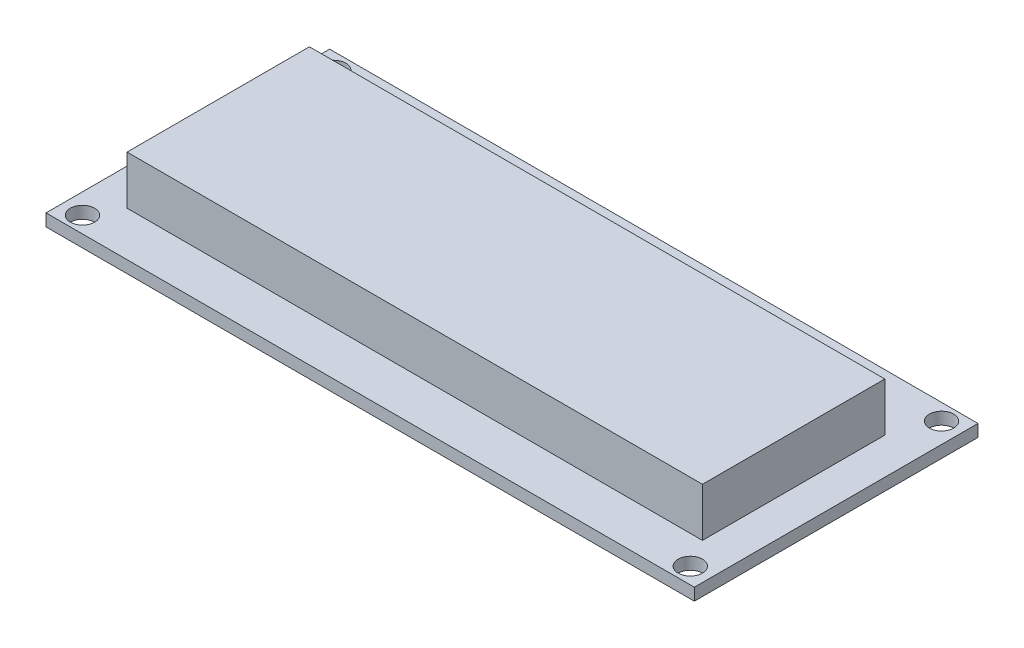
from build123d import *

# Parameters (mm, degrees)
SKETCH_1_W            = 80
SKETCH_1_H            = 35
SKETCH_1_R            = 1.5
EXTRUDE_1_DEPTH       = 1.5
EXTRUDE_START         = 7
EXTRUDE_2_OUTLINE_W   = 71
EXTRUDE_2_OUTLINE_H   = 6
EXTRUDE_2_OUTLINE_H_2 = 2
EXTRUDE_2_DEPTH       = 22.5
EXTRUDE_2_2_OUTLINE_W = 44.5
EXTRUDE_2_2_OUTLINE_H = 10
EXTRUDE_2_2_DEPTH     = 3.5


# Read off the part's stored shape, not the designer's step: Бобышка-Вытянуть2
with BuildPart() as part:
    # Эскиз1 (on Top Plane) → Бобышка-Вытянуть1 (new body)
    with BuildSketch(Plane(origin=(0, 0, 0), x_dir=(1, 0, 0), z_dir=(0, 1, 0))):
        with Locations((40, -17.5)):
            Rectangle(SKETCH_1_W, SKETCH_1_H)
        with Locations(Location((2.5, -2, 0), (0, 0, 270))):
            Circle(SKETCH_1_R, mode=Mode.SUBTRACT)
        with Locations(Location((77.5, -2, 0), (0, 0, 90))):
            Circle(SKETCH_1_R, mode=Mode.SUBTRACT)
        with Locations(Location((77.5, -33, 0), (0, 0, 270))):
            Circle(SKETCH_1_R, mode=Mode.SUBTRACT)
        with Locations(Location((2.5, -33, 0), (0, 0, 90))):
            Circle(SKETCH_1_R, mode=Mode.SUBTRACT)
    extrude(amount=EXTRUDE_1_DEPTH)

    # Бобышка-Вытянуть2 outline → Бобышка-Вытянуть2 (add)
    with BuildSketch(Plane.XY.offset(EXTRUDE_START)):
        with Locations((40, 4.5)):
            Rectangle(EXTRUDE_2_OUTLINE_W, EXTRUDE_2_OUTLINE_H)
        with Locations((40, -1)):
            Rectangle(EXTRUDE_2_OUTLINE_W, EXTRUDE_2_OUTLINE_H_2)
    extrude(amount=EXTRUDE_2_DEPTH)

    # Extrude 2 2 outline → Extrude 2 2 (add)
    with BuildSketch(Plane.XY):
        with Locations((27.75, -5)):
            Rectangle(EXTRUDE_2_2_OUTLINE_W, EXTRUDE_2_2_OUTLINE_H)
    extrude(amount=EXTRUDE_2_2_DEPTH)


solid = part.part
